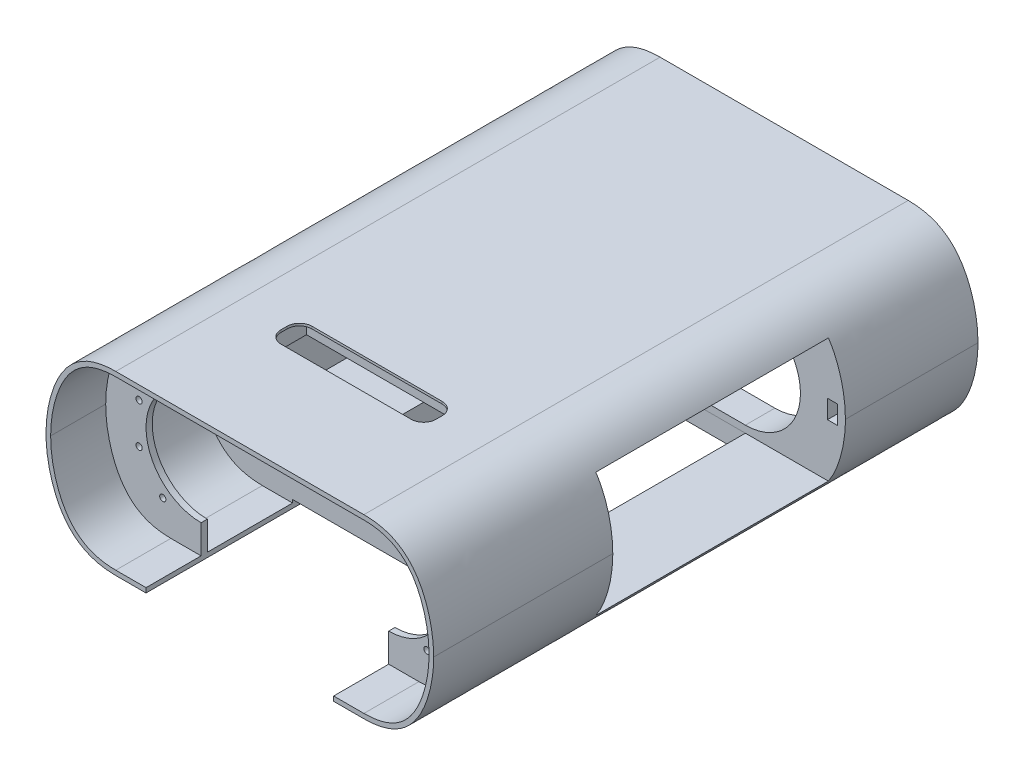
from build123d import *

# Parameters (mm, degrees)
EXTRUDE_1_DEPTH          = 140
EXTRUDE_1_DEPTH_BACK     = 140
EXTRUDE_3_DEPTH          = 35.5
CUT_EXTRUDE_2_REACH      = 197.473
SKETCH_6_W               = 150
SKETCH_6_H               = 80
CUT_EXTRUDE_4_DEPTH      = 6
EXTRUDE_4_DEPTH          = 60.5
CUT_EXTRUDE_START        = -59
CUT_EXTRUDE_6_DEPTH      = 55
CUT_EXTRUDE_START_2      = -4
CUT_EXTRUDE_7_DEPTH      = 27
CUT_EXTRUDE_8_DEPTH      = 35.5
CUT_EXTRUDE_START_3      = -35.5
CUT_EXTRUDE_9_DEPTH      = 35.5
EXTRUDE_5_REACH          = 300.939
SKETCH_25_W              = 121
SKETCH_25_H              = 10
EXTRUDE_6_DEPTH          = 21.5
SKETCH_27_W              = 121
SKETCH_27_H              = 52.5
EXTRUDE_7_DEPTH          = 1.5
SKETCH_28_W              = 121
SKETCH_28_H              = 2
EXTRUDE_8_DEPTH          = 10
CUT_EXTRUDE_11_REACH     = 346.114
SKETCH_29_R              = 2
PATTERN_CIRCULAR_2_COUNT = 10
CUT_EXTRUDE_12_REACH     = 346.114
SKETCH_30_R              = 2
PATTERN_CIRCULAR_3_COUNT = 10
MIRROR_START             = -140
MIRROR_10_OUTLINE_R      = 2
MIRROR_10_DEPTH          = 280
MIRROR_10_2_OUTLINE_R    = 2
MIRROR_10_2_DEPTH        = 4
MIRROR_START_2           = 136
MIRROR_10_3_OUTLINE_R    = 2
MIRROR_10_3_DEPTH        = 4
EXTRUDE_9_REACH          = 263.648
SKETCH_31_W              = 21
SKETCH_31_H              = 16.5
EXTRUDE_10_REACH         = 292.975
SKETCH_34_W              = 121
SKETCH_34_H              = 154
EXTRUDE_11_DEPTH         = 5
EXTRUDE_12_REACH         = 378.928
SKETCH_36_W              = 121
SKETCH_36_H              = 3
EXTRUDE_13_REACH         = 378.928
SKETCH_37_W              = 121
SKETCH_37_H              = 3
SKETCH_38_W              = 100
SKETCH_38_H              = 20
CUT_EXTRUDE_13_DEPTH     = 10
FILLET_1_R               = 8


# Read off the part's stored shape, not the designer's step: 镜向10
with BuildPart() as part:
    # 草图2 → 凸台-拉伸1 (new, two sides: drawn at the far end of the back side and taken through both)
    with BuildSketch(Plane.XY.offset(-EXTRUDE_1_DEPTH_BACK)):
        with BuildLine():
            Line((60.5, 57), (80, 57))
            add(Edge.make_bspline(
                [(80, 57), (110.715171184, 57), (118.023084898, 36.99301361), (125, 20.498008369), (125, 0)],
                knots=[0, 0, 0, 0, 0, 1, 1, 1, 1, 1], degree=4))
            add(Edge.make_bspline(
                [(80, -57), (110.715171184, -57), (118.023084898, -36.99301361), (125, -20.498008369), (125, 0)],
                knots=[0, 0, 0, 0, 0, 1, 1, 1, 1, 1], degree=4))
            Line((80, -57), (60.5, -57))
            Line((60.5, -57), (60.5, -35.5))
            ThreePointArc((60.5, -35.5), (96, 0), (60.5, 35.5))
            Line((60.5, 35.5), (60.5, 57))
        make_face()
    extrude(amount=EXTRUDE_1_DEPTH + EXTRUDE_1_DEPTH_BACK)

    # 草图5 → 凸台-拉伸3 (add)
    with BuildSketch(Plane.XY.offset(140)):
        with BuildLine():
            Line((60.5, -50), (60.5, -57))
            Line((60.5, -57), (80, -57))
            add(Edge.make_bspline(
                [(80, -57), (110.715171184, -57), (118.023084898, -36.99301361), (125, -20.498008369), (125, 0)],
                knots=[0, 0, 0, 0, 0, 1, 1, 1, 1, 1], degree=4))
            add(Edge.make_bspline(
                [(125, 0), (125, 20.498008369), (118.023084898, 36.99301361), (110.715171184, 57), (80, 57)],
                knots=[0, 0, 0, 0, 0, 1, 1, 1, 1, 1], degree=4))
            Line((80, 57), (60.5, 57))
            Line((60.5, 57), (60.5, 50))
            ThreePointArc((60.5, 50), (110.5, 0), (60.5, -50))
        make_face()
    extrude_3 = extrude(amount=EXTRUDE_3_DEPTH)

    # 镜向2: 凸台-拉伸3 across plane
    add(extrude_3.mirror(Plane.XY))

    # 草图6 → 切除-拉伸2 (cut, up to next)
    with BuildSketch(Plane.ZY.offset(-60.5), mode=Mode.PRIVATE) as cut_extrude_2_sk1:
        with Locations((-15, 0)):
            Rectangle(SKETCH_6_W, SKETCH_6_H)
    cut_extrude_2_tool1 = extrude(cut_extrude_2_sk1.sketch, amount=-CUT_EXTRUDE_2_REACH, mode=Mode.PRIVATE) & part.part
    add(cut_extrude_2_tool1.solids().sort_by_distance((60.5, 0, -15))[0], mode=Mode.SUBTRACT)

    # 草图9 → 切除-拉伸4 (cut, symmetric)
    with BuildSketch(Plane(origin=(0, 0, 0), x_dir=(1, 0, 0), z_dir=(0, 1, 0))):
        Polygon((113.429186382, -60), (119.929186382, -60), (119.929186382, -75), (116.929186382, -75), (111.929186382, -69.041232037), (113.429186382, -67.541232037), align=None)
    cut_extrude_4 = extrude(amount=CUT_EXTRUDE_4_DEPTH, both=True, mode=Mode.SUBTRACT)

    # 镜向3: 切除-拉伸4 across plane
    add(cut_extrude_4.mirror(Plane(origin=(0, 0, -15), x_dir=(1, 0, 0), z_dir=(0, 0, -1))), mode=Mode.SUBTRACT)

    # 草图10 → 凸台-拉伸4 (add)
    with BuildSketch(Plane.ZY.offset(-60.5)):
        Polygon((-90, 40), (-90, 35.5), (-92, 35.5), (-92, 42), (62, 42), (62, 35.5), (60, 35.5), (60, 40), align=None)
    extrude(amount=EXTRUDE_4_DEPTH)

    # 草图18 → 切除-拉伸6 (cut)
    with BuildSketch(Plane.XY.offset(140).offset(CUT_EXTRUDE_START)):
        with BuildLine():
            Line((60.5, 54), (60.5, 35.5))
            ThreePointArc((60.5, 35.5), (96, 0), (60.5, -35.5))
            Line((60.5, -35.5), (60.5, -54))
            Line((60.5, -54), (80, -54))
            add(Edge.make_bspline(
                [(80, -54), (84.874930894, -54), (88.983824843, -53.408674679), (94.293485921, -51.914645093), (95.921328006, -51.314644751), (98.940749379, -49.944603182), (100.332473442, -49.174486853), (102.921509382, -47.489185635), (104.118858715, -46.573864409), (106.351651802, -44.617586852), (107.387031345, -43.57654345), (110.285874468, -40.291394559), (111.943828956, -37.885646851), (114.834227827, -32.778060673), (116.065931681, -30.077252128), (118.174928997, -24.486846885), (119.052306998, -21.597764181), (120.481395372, -15.683640995), (121.033233096, -12.658872533), (121.792444122, -6.461288023), (122, -3.288695832), (122, 0)],
                knots=[0, 0, 0, 0, 0.125, 0.125, 0.1875, 0.1875, 0.25, 0.25, 0.3125, 0.3125, 0.375, 0.375, 0.5, 0.5, 0.625, 0.625, 0.75, 0.75, 0.875, 0.875, 1, 1, 1, 1], degree=3))
            add(Edge.make_bspline(
                [(122, 0), (122, 3.288695832), (121.792444122, 6.461288023), (121.033233096, 12.658872533), (120.481395372, 15.683640995), (119.052306998, 21.597764181), (118.174928997, 24.486846885), (116.065931681, 30.077252128), (114.834227827, 32.778060673), (111.943828956, 37.885646851), (110.285874468, 40.291394559), (107.387031345, 43.57654345), (106.351651802, 44.617586852), (104.118858715, 46.573864409), (102.921509382, 47.489185635), (100.332473442, 49.174486853), (98.940749379, 49.944603182), (95.921328006, 51.314644751), (94.293485921, 51.914645093), (88.983824843, 53.408674679), (84.874930894, 54), (80, 54)],
                knots=[0, 0, 0, 0, 0.125, 0.125, 0.25, 0.25, 0.375, 0.375, 0.5, 0.5, 0.625, 0.625, 0.6875, 0.6875, 0.75, 0.75, 0.8125, 0.8125, 0.875, 0.875, 1, 1, 1, 1], degree=3))
            Line((80, 54), (60.5, 54))
        make_face()
    extrude(amount=CUT_EXTRUDE_6_DEPTH, mode=Mode.SUBTRACT)

    # 草图19 → 切除-拉伸7 (cut)
    with BuildSketch(Plane(origin=(0, 0, -140), x_dir=(-1, 0, 0), z_dir=(0, 0, -1)).offset(CUT_EXTRUDE_START_2)):
        with BuildLine():
            Line((-60.5, 54), (-60.5, 35.5))
            ThreePointArc((-60.5, 35.5), (-96, 0), (-60.5, -35.5))
            Line((-60.5, -35.5), (-60.5, -54))
            Line((-60.5, -54), (-80, -54))
            add(Edge.make_bspline(
                [(-80, -54), (-84.874930894, -54), (-88.983824843, -53.408674679), (-94.293485921, -51.914645093), (-95.921328006, -51.314644751), (-98.940749379, -49.944603182), (-100.332473442, -49.174486853), (-102.921509382, -47.489185635), (-104.118858715, -46.573864409), (-106.351651802, -44.617586852), (-107.387031345, -43.57654345), (-110.285874468, -40.291394559), (-111.943828956, -37.885646851), (-114.834227827, -32.778060673), (-116.065931681, -30.077252128), (-118.174928997, -24.486846885), (-119.052306998, -21.597764181), (-120.481395372, -15.683640995), (-121.033233096, -12.658872533), (-121.792444122, -6.461288023), (-122, -3.288695832), (-122, 0)],
                knots=[0, 0, 0, 0, 0.125, 0.125, 0.1875, 0.1875, 0.25, 0.25, 0.3125, 0.3125, 0.375, 0.375, 0.5, 0.5, 0.625, 0.625, 0.75, 0.75, 0.875, 0.875, 1, 1, 1, 1], degree=3))
            add(Edge.make_bspline(
                [(-122, 0), (-122, 3.288695832), (-121.792444122, 6.461288023), (-121.033233096, 12.658872533), (-120.481395372, 15.683640995), (-119.052306998, 21.597764181), (-118.174928997, 24.486846885), (-116.065931681, 30.077252128), (-114.834227827, 32.778060673), (-111.943828956, 37.885646851), (-110.285874468, 40.291394559), (-107.387031345, 43.57654345), (-106.351651802, 44.617586852), (-104.118858715, 46.573864409), (-102.921509382, 47.489185635), (-100.332473442, 49.174486853), (-98.940749379, 49.944603182), (-95.921328006, 51.314644751), (-94.293485921, 51.914645093), (-88.983824843, 53.408674679), (-84.874930894, 54), (-80, 54)],
                knots=[0, 0, 0, 0, 0.125, 0.125, 0.25, 0.25, 0.375, 0.375, 0.5, 0.5, 0.625, 0.625, 0.6875, 0.6875, 0.75, 0.75, 0.8125, 0.8125, 0.875, 0.875, 1, 1, 1, 1], degree=3))
            Line((-80, 54), (-60.5, 54))
        make_face()
    extrude(amount=-CUT_EXTRUDE_7_DEPTH, mode=Mode.SUBTRACT)

    # 草图20 → 切除-拉伸8 (cut)
    with BuildSketch(Plane.XY.offset(175.5)):
        with BuildLine():
            Line((60.5, 54), (60.5, 50))
            ThreePointArc((60.5, 50), (110.5, 0), (60.5, -50))
            Line((60.5, -50), (60.5, -54))
            Line((60.5, -54), (80, -54))
            add(Edge.make_bspline(
                [(80, -54), (84.874930894, -54), (88.983824843, -53.408674679), (94.293485921, -51.914645093), (95.921328006, -51.314644751), (98.940749379, -49.944603182), (100.332473442, -49.174486853), (102.921509382, -47.489185635), (104.118858715, -46.573864409), (106.351651802, -44.617586852), (107.387031345, -43.57654345), (110.285874468, -40.291394559), (111.943828956, -37.885646851), (114.834227827, -32.778060673), (116.065931681, -30.077252128), (118.174928997, -24.486846885), (119.052306998, -21.597764181), (120.481395372, -15.683640995), (121.033233096, -12.658872533), (121.792444122, -6.461288023), (122, -3.288695832), (122, 0)],
                knots=[0, 0, 0, 0, 0.125, 0.125, 0.1875, 0.1875, 0.25, 0.25, 0.3125, 0.3125, 0.375, 0.375, 0.5, 0.5, 0.625, 0.625, 0.75, 0.75, 0.875, 0.875, 1, 1, 1, 1], degree=3))
            add(Edge.make_bspline(
                [(122, 0), (122, 3.288695832), (121.792444122, 6.461288023), (121.033233096, 12.658872533), (120.481395372, 15.683640995), (119.052306998, 21.597764181), (118.174928997, 24.486846885), (116.065931681, 30.077252128), (114.834227827, 32.778060673), (111.943828956, 37.885646851), (110.285874468, 40.291394559), (107.387031345, 43.57654345), (106.351651802, 44.617586852), (104.118858715, 46.573864409), (102.921509382, 47.489185635), (100.332473442, 49.174486853), (98.940749379, 49.944603182), (95.921328006, 51.314644751), (94.293485921, 51.914645093), (88.983824843, 53.408674679), (84.874930894, 54), (80, 54)],
                knots=[0, 0, 0, 0, 0.125, 0.125, 0.25, 0.25, 0.375, 0.375, 0.5, 0.5, 0.625, 0.625, 0.6875, 0.6875, 0.75, 0.75, 0.8125, 0.8125, 0.875, 0.875, 1, 1, 1, 1], degree=3))
            Line((80, 54), (60.5, 54))
        make_face()
    extrude(amount=-CUT_EXTRUDE_8_DEPTH, mode=Mode.SUBTRACT)

    # 草图21 → 切除-拉伸9 (cut)
    with BuildSketch(Plane(origin=(0, 0, -175.5), x_dir=(-1, 0, 0), z_dir=(0, 0, -1)).offset(CUT_EXTRUDE_START_3)):
        with BuildLine():
            Line((-60.5, -50), (-60.5, -54))
            Line((-60.5, -54), (-80, -54))
            add(Edge.make_bspline(
                [(-80, -54), (-84.874930894, -54), (-88.983824843, -53.408674679), (-94.293485921, -51.914645093), (-95.921328006, -51.314644751), (-98.940749379, -49.944603182), (-100.332473442, -49.174486853), (-102.921509382, -47.489185635), (-104.118858715, -46.573864409), (-106.351651802, -44.617586852), (-107.387031345, -43.57654345), (-110.285874468, -40.291394559), (-111.943828956, -37.885646851), (-114.834227827, -32.778060673), (-116.065931681, -30.077252128), (-118.174928997, -24.486846885), (-119.052306998, -21.597764181), (-120.481395372, -15.683640995), (-121.033233096, -12.658872533), (-121.792444122, -6.461288023), (-122, -3.288695832), (-122, 0)],
                knots=[0, 0, 0, 0, 0.125, 0.125, 0.1875, 0.1875, 0.25, 0.25, 0.3125, 0.3125, 0.375, 0.375, 0.5, 0.5, 0.625, 0.625, 0.75, 0.75, 0.875, 0.875, 1, 1, 1, 1], degree=3))
            add(Edge.make_bspline(
                [(-122, 0), (-122, 3.288695832), (-121.792444122, 6.461288023), (-121.033233096, 12.658872533), (-120.481395372, 15.683640995), (-119.052306998, 21.597764181), (-118.174928997, 24.486846885), (-116.065931681, 30.077252128), (-114.834227827, 32.778060673), (-111.943828956, 37.885646851), (-110.285874468, 40.291394559), (-107.387031345, 43.57654345), (-106.351651802, 44.617586852), (-104.118858715, 46.573864409), (-102.921509382, 47.489185635), (-100.332473442, 49.174486853), (-98.940749379, 49.944603182), (-95.921328006, 51.314644751), (-94.293485921, 51.914645093), (-88.983824843, 53.408674679), (-84.874930894, 54), (-80, 54)],
                knots=[0, 0, 0, 0, 0.125, 0.125, 0.25, 0.25, 0.375, 0.375, 0.5, 0.5, 0.625, 0.625, 0.6875, 0.6875, 0.75, 0.75, 0.8125, 0.8125, 0.875, 0.875, 1, 1, 1, 1], degree=3))
            Line((-80, 54), (-60.5, 54))
            Line((-60.5, 54), (-60.5, 50))
            ThreePointArc((-60.5, 50), (-110.5, 0), (-60.5, -50))
        make_face()
    extrude(amount=CUT_EXTRUDE_9_DEPTH, mode=Mode.SUBTRACT)

    # 镜向9: part across plane


with BuildPart() as part_1:
    add(part.part)
    add(part.part.mirror(Plane.ZY))

    # 草图23 → 凸台-拉伸5 (add, up to next)
    with BuildSketch(Plane.XY.offset(-90), mode=Mode.PRIVATE) as extrude_5_sk1:
        with BuildLine():
            Line((-114.034351089, 40), (-110, 40))
            Line((-110, 40), (-110, -40))
            Line((-110, -40), (-114.034351089, -40))
            add(Edge.make_bspline(
                [(-114.034351089, -40), (-119.771865737, -31.446745908), (-122.888445187, -21.34184926), (-125, -11.276676628), (-125, 0)],
                knots=[0.449864766, 0.449864766, 0.449864766, 0.449864766, 0.449864766, 1, 1, 1, 1, 1], degree=4))
            add(Edge.make_bspline(
                [(-125, 0), (-125, 11.276676628), (-122.888445187, 21.34184926), (-119.771865737, 31.446745908), (-114.034351089, 40)],
                knots=[0, 0, 0, 0, 0, 0.550135234, 0.550135234, 0.550135234, 0.550135234, 0.550135234], degree=4))
        make_face()
    extrude_5_tool1 = extrude(extrude_5_sk1.sketch, amount=EXTRUDE_5_REACH, mode=Mode.PRIVATE) - part_1.part
    add(extrude_5_tool1.solids().sort_by_distance((-116.2158, 0, -90))[0])

    # 草图25 → 凸台-拉伸6 (add)
    with BuildSketch(Plane(origin=(0, 57, 0), x_dir=(1, 0, 0), z_dir=(0, 1, 0))):
        with Locations((0, -67)):
            Rectangle(SKETCH_25_W, SKETCH_25_H)
    extrude(amount=-EXTRUDE_6_DEPTH)



with BuildPart() as body_2:
    # 草图27 → 凸台-拉伸7 (new body)
    with BuildSketch(Plane(origin=(0, 57, 0), x_dir=(1, 0, 0), z_dir=(0, 1, 0))):
        with Locations((0, -98.25)):
            Rectangle(SKETCH_27_W, SKETCH_27_H)
    extrude(amount=-EXTRUDE_7_DEPTH)


with BuildPart() as part_2:
    add(part_1.part)

    add(body_2.part)  # 凸台-拉伸8 merges body 2
    # 草图28 → 凸台-拉伸8 (add)
    with BuildSketch(Plane(origin=(0, 57, 0), x_dir=(1, 0, 0), z_dir=(0, 1, 0))):
        with Locations((0, -125.5)):
            Rectangle(SKETCH_28_W, SKETCH_28_H)
    extrude(amount=-EXTRUDE_8_DEPTH)

    # 草图29 → 切除-拉伸11 (cut, up to next)
    with BuildSketch(Plane.XY.offset(140), mode=Mode.PRIVATE) as cut_extrude_11_sk1:
        with Locations((-85.186980596, 33.978713764)):
            Circle(SKETCH_29_R)
    cut_extrude_11_tool1 = extrude(cut_extrude_11_sk1.sketch, amount=-CUT_EXTRUDE_11_REACH, mode=Mode.PRIVATE) & part_2.part
    cut_extrude_11 = cut_extrude_11_tool1.solids().sort_by_distance((-85.186981, 33.978714, 140))[0]
    add(cut_extrude_11, mode=Mode.SUBTRACT)

    # 阵列(圆周)2: 切除-拉伸11 ×10 about axis, 6 skipped
    pattern_circular_2_axis = Axis((-60.5, 0, 140), (0, 0, -1))
    add([cut_extrude_11.rotate(pattern_circular_2_axis, i * 360 / PATTERN_CIRCULAR_2_COUNT) for i in range(1, PATTERN_CIRCULAR_2_COUNT) if i not in (1, 2, 3, 4, 5, 6)], mode=Mode.SUBTRACT)

    # 草图30 → 切除-拉伸12 (cut, up to next)
    with BuildSketch(Plane(origin=(0, 0, -140), x_dir=(-1, 0, 0), z_dir=(0, 0, -1)), mode=Mode.PRIVATE) as cut_extrude_12_sk1:
        with Locations(Location((85.186980596, 33.978713764, 0), (0, 0, 180))):
            Circle(SKETCH_30_R)
    cut_extrude_12_tool1 = extrude(cut_extrude_12_sk1.sketch, amount=-CUT_EXTRUDE_12_REACH, mode=Mode.PRIVATE) & part_2.part
    cut_extrude_12 = cut_extrude_12_tool1.solids().sort_by_distance((-85.186981, 33.978714, -140))[0]
    add(cut_extrude_12, mode=Mode.SUBTRACT)

    # 阵列(圆周)3: 切除-拉伸12 ×10 about axis, 6 skipped
    pattern_circular_3_axis = Axis((-60.5, 0, 140), (0, 0, -1))
    add([cut_extrude_12.rotate(pattern_circular_3_axis, i * 360 / PATTERN_CIRCULAR_3_COUNT) for i in range(1, PATTERN_CIRCULAR_3_COUNT) if i not in (1, 2, 3, 4, 5, 6)], mode=Mode.SUBTRACT)

    # 镜向10 outline → 镜向10 (cut)
    with BuildSketch(Plane.XY.offset(MIRROR_START)):
        with Locations((85.186980596, 33.978713764)):
            Circle(MIRROR_10_OUTLINE_R)
    extrude(amount=MIRROR_10_DEPTH, mode=Mode.SUBTRACT)

    # Mirror 10 2 outline → Mirror 10 2 (cut)
    with BuildSketch(Plane.XY.offset(MIRROR_START)):
        with Locations((100.444373684, 12.978713764)):
            Circle(MIRROR_10_2_OUTLINE_R)
        with Locations((100.444373684, -12.978713764)):
            Circle(MIRROR_10_2_OUTLINE_R)
        with Locations((85.186980596, -33.978713764)):
            Circle(MIRROR_10_2_OUTLINE_R)
    extrude(amount=MIRROR_10_2_DEPTH, mode=Mode.SUBTRACT)

    # Mirror 10 3 outline → Mirror 10 3 (cut)
    with BuildSketch(Plane.XY.offset(MIRROR_START_2)):
        with Locations((100.444373684, 12.978713764)):
            Circle(MIRROR_10_3_OUTLINE_R)
        with Locations((100.444373684, -12.978713764)):
            Circle(MIRROR_10_3_OUTLINE_R)
        with Locations((85.186980596, -33.978713764)):
            Circle(MIRROR_10_3_OUTLINE_R)
    extrude(amount=MIRROR_10_3_DEPTH, mode=Mode.SUBTRACT)

    # 草图31 → 凸台-拉伸9 (add, up to next)
    with BuildSketch(Plane(origin=(-60.5, 0, 0), x_dir=(0, 0, -1), z_dir=(1, 0, 0)), mode=Mode.PRIVATE) as extrude_9_sk1:
        with Locations((-70.5, -43.75)):
            Rectangle(SKETCH_31_W, SKETCH_31_H)
    extrude_9_tool1 = extrude(extrude_9_sk1.sketch, amount=EXTRUDE_9_REACH, mode=Mode.PRIVATE) - part_2.part
    # 草图31 → 凸台-拉伸9 (add, up to next)
    with BuildSketch(Plane(origin=(-60.5, 0, 0), x_dir=(0, 0, -1), z_dir=(1, 0, 0)), mode=Mode.PRIVATE) as extrude_9_sk2:
        Polygon((109, -52), (109, -35.5), (90, -35.5), (90, -40), (90, -52), align=None)
    extrude_9_tool2 = extrude(extrude_9_sk2.sketch, amount=EXTRUDE_9_REACH, mode=Mode.PRIVATE) - part_2.part
    add(extrude_9_tool1.solids().sort_by_distance((-60.5, -43.75, 70.5))[0])
    add(extrude_9_tool2.solids().sort_by_distance((-60.5, -43.75, -99.5))[0])

    # 草图33 → 凸台-拉伸10 (add, up to next)
    with BuildSketch(Plane.XY.offset(81), mode=Mode.PRIVATE) as extrude_10_sk1:
        with BuildLine():
            Line((62.5, 54), (62.5, 35.443617197))
            ThreePointArc((62.5, 35.443617197), (61.500397299, 35.4859015), (60.5, 35.5))
            Line((60.5, 35.5), (60.5, 54))
            Line((60.5, 54), (62.5, 54))
        make_face()
    extrude_10_tool1 = extrude(extrude_10_sk1.sketch, amount=EXTRUDE_10_REACH, mode=Mode.PRIVATE) - part_2.part
    extrude_10 = extrude_10_tool1.solids().sort_by_distance((61.500507, 44.740598, 81))[0]
    add(extrude_10)

    # 镜向11: 凸台-拉伸10 across plane
    add(extrude_10.mirror(Plane(origin=(0, 0, 0), x_dir=(0, 0, 1), z_dir=(1, 0, 0))))

    # 草图34 → 凸台-拉伸11 (add)
    with BuildSketch(Plane(origin=(0, 42, 0), x_dir=(1, 0, 0), z_dir=(0, 1, 0))):
        with Locations((0, 15)):
            Rectangle(SKETCH_34_W, SKETCH_34_H)
    extrude(amount=EXTRUDE_11_DEPTH)

    # 草图36 → 凸台-拉伸12 (add, up to next)
    with BuildSketch(Plane.XY.offset(175.5), mode=Mode.PRIVATE) as extrude_12_sk1:
        with Locations((0, 55.5)):
            Rectangle(SKETCH_36_W, SKETCH_36_H)
    extrude_12_tool1 = extrude(extrude_12_sk1.sketch, amount=-EXTRUDE_12_REACH, mode=Mode.PRIVATE) - part_2.part
    add(extrude_12_tool1.solids().sort_by_distance((0, 55.5, 175.5))[0])

    # 草图37 → 凸台-拉伸13 (add, up to next)
    with BuildSketch(Plane(origin=(0, 0, -175.5), x_dir=(-1, 0, 0), z_dir=(0, 0, -1)), mode=Mode.PRIVATE) as extrude_13_sk1:
        with Locations((0, 55.5)):
            Rectangle(SKETCH_37_W, SKETCH_37_H)
    extrude_13_tool1 = extrude(extrude_13_sk1.sketch, amount=-EXTRUDE_13_REACH, mode=Mode.PRIVATE) - part_2.part
    add(extrude_13_tool1.solids().sort_by_distance((0, 55.5, -175.5))[0])

    # 草图38 → 切除-拉伸13 (cut)
    with BuildSketch(Plane.XZ.offset(-55.5)):
        with Locations((0, 97)):
            Rectangle(SKETCH_38_W, SKETCH_38_H)
    extrude(amount=-CUT_EXTRUDE_13_DEPTH, mode=Mode.SUBTRACT)

    # 圆角1
    fillet_1_edges = [part_2.edges().sort_by_distance(p)[0] for p in [
        (50, 56.25, 107),
        (50, 56.25, 87),
        (-50, 56.25, 87),
        (-50, 56.25, 107),
    ]]
    fillet(fillet_1_edges, radius=FILLET_1_R)


solid = part_2.part
